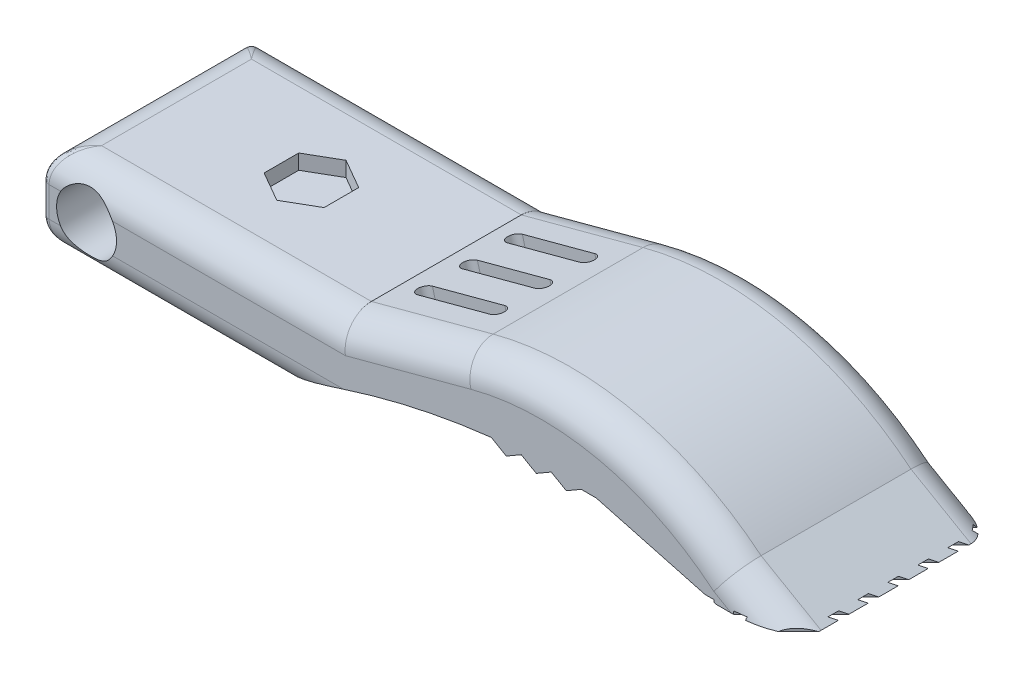
from build123d import *

# Parameters (mm, degrees)
BOSS_EXTRUDE1_DEPTH  = 7
FILLET4_R            = 2
FILLET4_2_R          = 0.5
SKETCH2_R            = 2
CUT_EXTRUDE1_DEPTH   = 3
CUT_EXTRUDE2_DEPTH   = 1
CUT_EXTRUDE3_DEPTH   = 1
LPATTERN1_COUNT      = 2
LPATTERN1_PITCH      = 3
LPATTERN1_COUNT_DIR2 = 2
LPATTERN1_PITCH_DIR2 = 3
CUT_EXTRUDE4_DEPTH   = 0.2
LPATTERN2_COUNT      = 5
LPATTERN2_PITCH      = 2
LPATTERN2_COUNT_DIR2 = 6
LPATTERN2_PITCH_DIR2 = 2


with BuildPart() as part:
    # Sketch1 → Boss-Extrude1 (new, symmetric)
    with BuildSketch(Plane.XY):
        with BuildLine():
            Line((15, 0), (0, 0))
            Line((0, 0), (0, 6))
            Line((0, 6), (20, 6))
            Line((20, 6), (28.124003736, 8.17682024))
            ThreePointArc((28.124003736, 8.17682024), (37.528653128, 8.406238275), (45.997797453, 4.310672718))
            Line((45.997797453, 4.310672718), (50, 2))
            Line((50, 2), (45, 2))
            Line((45, 2), (37, 4.143593539))
            Line((37, 4.143593539), (36, 4.143593539))
            Line((36, 4.143593539), (35, 3.56624327))
            Line((35, 3.56624327), (34, 4.143593539))
            Line((34, 4.143593539), (33, 3.56624327))
            Line((33, 3.56624327), (32, 4.143593539))
            Line((32, 4.143593539), (31, 3.56624327))
            Line((31, 3.56624327), (30, 4.143593539))
            ThreePointArc((30, 4.143593539), (22.337807681, 2.658940457), (15, 0))
        make_face()
    extrude(amount=BOSS_EXTRUDE1_DEPTH, both=True)

    # Fillet4
    fillet4_edges = [part.edges().sort_by_distance(p)[0] for p in [
        (24.062001868, 7.08841012, 7),
        (47.998898727, 3.155336359, 7),
        (24.062001868, 7.08841012, -7),
        (47.998898727, 3.155336359, -7),
        (10, 6, 7),
        (10, 6, -7),
        (7.5, 0, 7),
        (7.5, 0, -7),
        (0, 6, 0),
        (0, 0, 0),
    ]]
    fillet(fillet4_edges, radius=FILLET4_R)

    # Fillet4 2
    fillet4_2_edges = [part.edges().sort_by_distance(p)[0] for p in [
        (0, 3, -7),
        (0, 3, 7),
    ]]
    fillet(fillet4_2_edges, radius=FILLET4_2_R)

    # Sketch2 → Cut-Extrude1 (cut)
    with BuildSketch(Plane.XY.offset(7)):
        with Locations((3, 2.988817981)):
            Circle(SKETCH2_R)
    cut_extrude1 = extrude(amount=-CUT_EXTRUDE1_DEPTH, mode=Mode.SUBTRACT)

    # Mirror1: Cut-Extrude1 across plane
    add(cut_extrude1.mirror(Plane.XY), mode=Mode.SUBTRACT)

    # Sketch3 → Cut-Extrude2 (cut)
    with BuildSketch(Plane(origin=(0, 6, 0), x_dir=(1, 0, 0), z_dir=(0, 1, 0))):
        Polygon((11, -2.309401077), (13, -1.154700538), (13, 1.154700538), (11, 2.309401077), (9, 1.154700538), (9, -1.154700538), align=None)
    extrude(amount=-CUT_EXTRUDE2_DEPTH, mode=Mode.SUBTRACT)

    # Sketch4 → Cut-Extrude3 (cut)
    with BuildSketch(Plane(origin=(-0.160254038, 0.598076211, 0), x_dir=(0.9659258262890679, 0.25881904510252235, 0), z_dir=(-0.25881904510252235, 0.965925826289068, 0))):
        with BuildLine():
            Line((22.5, 0.5), (27.5, 0.5))
            ThreePointArc((27.5, 0.5), (28, 0), (27.5, -0.5))
            Line((27.5, -0.5), (22.5, -0.5))
            ThreePointArc((22.5, -0.5), (22, 0), (22.5, 0.5))
        make_face()
    cut_extrude3 = extrude(amount=-CUT_EXTRUDE3_DEPTH, mode=Mode.SUBTRACT)

    # LPattern1: Cut-Extrude3 2 × 2
    with Locations(*[Vector(0, 0, -1) * (i * LPATTERN1_PITCH) + Vector(0, 0, 1) * (j * LPATTERN1_PITCH_DIR2) for i in range(LPATTERN1_COUNT) for j in range(LPATTERN1_COUNT_DIR2) if (i, j) != (0, 0)]):
        add(cut_extrude3, mode=Mode.SUBTRACT)

    # Sketch5 → Cut-Extrude4 (cut)
    with BuildSketch(Plane.XZ.offset(-2)):
        Polygon((52.626524164, -5.480077554), (42.019922446, 5.126524164), (42.373475836, 5.480077554), (52.980077554, -5.126524164), align=None)
    cut_extrude4 = extrude(amount=-CUT_EXTRUDE4_DEPTH, mode=Mode.SUBTRACT)

    # LPattern2: Cut-Extrude4 5 × 6
    with Locations(*[Vector(0, 0, 1) * (i * LPATTERN2_PITCH) + Vector(0, 0, -1) * (j * LPATTERN2_PITCH_DIR2) for i in range(LPATTERN2_COUNT) for j in range(LPATTERN2_COUNT_DIR2) if (i, j) != (0, 0)]):
        add(cut_extrude4, mode=Mode.SUBTRACT)


solid = part.part
